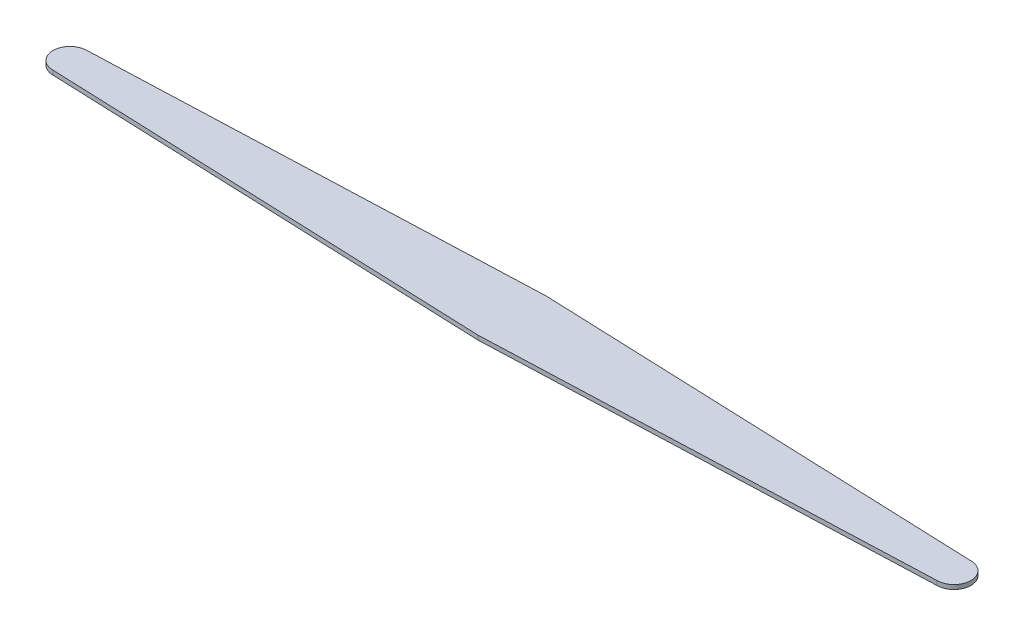
from build123d import *

# Parameters (mm, degrees)
BOSS_EXTRUDE1_DEPTH = 3.18


with BuildPart() as part:
    # Sketch2 → Boss-Extrude1 (new body)
    with BuildSketch(Plane(origin=(0, 0, 0), x_dir=(1, 0, 0), z_dir=(0, 1, 0))):
        with BuildLine():
            Line((-325, 12.5), (0, 25))
            Line((0, 25), (325, 12.5))
            ThreePointArc((325, 12.5), (337.5, 0), (325, -12.5))
            Line((325, -12.5), (0, -25))
            Line((0, -25), (-325, -12.5))
            ThreePointArc((-325, -12.5), (-337.5, 0), (-325, 12.5))
        make_face()
    extrude(amount=BOSS_EXTRUDE1_DEPTH)


solid = part.part
